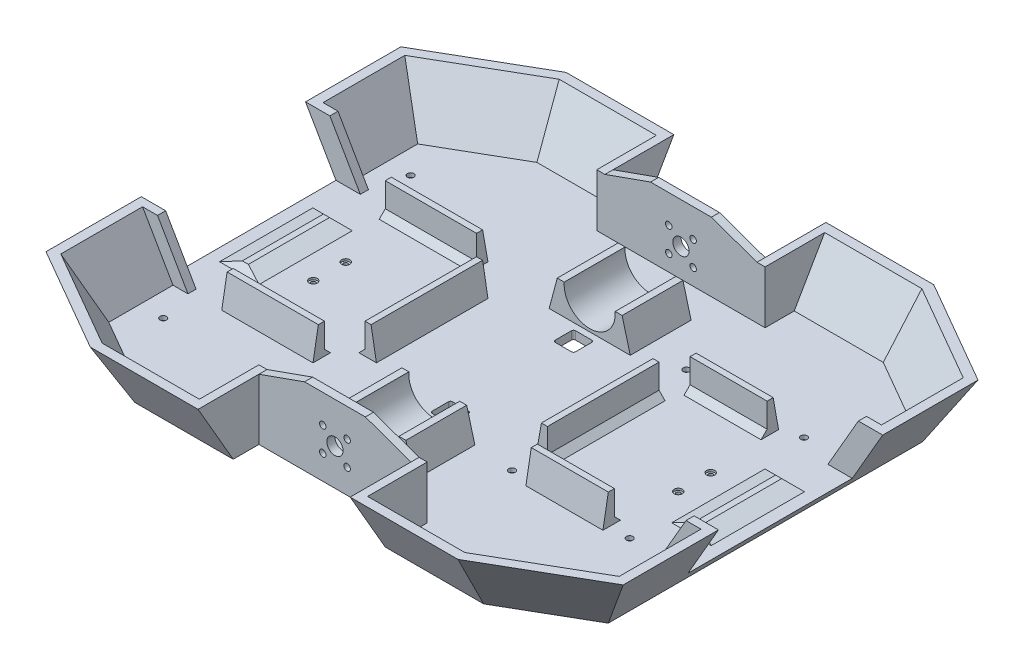
from build123d import *
from OCP.BRepFilletAPI import BRepFilletAPI_MakeChamfer

# Parameters (mm, degrees)
BOSS_EXTRUDE1_DEPTH                      = 30
DRAFT1_ANGLE                             = 30
SHELL1_T                                 = -4
SKETCH2_W                                = 75
SKETCH2_H                                = 30
CUT_EXTRUDE1_DEPTH                       = 187.866874095
BOSS_EXTRUDE2_DEPTH                      = 4
BOSS_EXTRUDE4_DEPTH                      = 4
SKETCH5_R                                = 1.6
SKETCH5_R_2                              = 4
CUT_EXTRUDE2_DEPTH                       = 5
SKETCH9_W                                = 30
SKETCH9_H                                = 30
BOSS_EXTRUDE5_DEPTH                      = 15
CUT_EXTRUDE5_REACH                       = 238.985
SKETCH10_R                               = 12.6
CHAMFER4_SIZE                            = 5
CHAMFER4_SIZE_2                          = 18.660254038
SKETCH15_W                               = 10
SKETCH15_H                               = 10
CUT_EXTRUDE8_DEPTH                       = 188.550602862
FILLET1_R                                = 1
MIRROR4_COPY_1_DEPTH                     = 4
CHAMFER4_OF_MIRROR4_SIZE                 = 5
CHAMFER4_OF_MIRROR4_SIZE_2               = 18.660254038
FILLET1_OF_MIRROR4_R                     = 1
CUT_EXTRUDE9_REACH                       = 190.317
SKETCH16_R                               = 1.1
SKETCH17_R                               = 2
CUT_EXTRUDE10_DEPTH                      = 1
SKETCH6_R                                = 1.6
CUT_EXTRUDE3_DEPTH                       = 5
SKETCH7_R                                = 3.5
CUT_EXTRUDE4_DEPTH                       = 2
SKETCH19_R                               = 1.6
CUT_EXTRUDE11_DEPTH                      = 188.550602862
SKETCH20_R                               = 3.5
CUT_EXTRUDE12_DEPTH                      = 2
SKETCH18_W                               = 45
SKETCH18_H                               = 3
SKETCH18_W_2                             = 3
SKETCH18_H_2                             = 55
SKETCH18_W_3                             = 38
BOSS_EXTRUDE8_DEPTH                      = 15
CHAMFER9_SIZE                            = 2.644904711
CHAMFER9_SIZE_2                          = 15
CHAMFER13_SIZE                           = 3
SKETCH21_W                               = 3
SKETCH21_H                               = 40
BOSS_EXTRUDE9_DEPTH                      = 3
CHAMFER10_SIZE                           = 8.242432258
CHAMFER10_SIZE_2                         = 3
CHAMFER11_SIZE                           = 3
CUT_EXTRUDE13_START                      = -19.629909
SKETCH22_W                               = 81
SKETCH22_H                               = 26
CUT_EXTRUDE13_DEPTH                      = 19.629909
BOSS_EXTRUDE10_DEPTH                     = 4
MIRROR6_AT_THE_SECOND_PLANE_COPY_1_DEPTH = 4


# Some blends are built 0.0001 mm under size
with BuildPart() as part:
    # Sketch1 → Boss-Extrude1 (new body)
    with BuildSketch(Plane(origin=(0, 0, 0), x_dir=(1, 0, 0), z_dir=(0, 1, 0))):
        Polygon((-125, 77.5), (-86.02885683, 100), (86.02885683, 100), (125, 77.5), (125, -77.5), (86.02885683, -100), (-86.02885683, -100), (-125, -77.5), align=None)
    extrude(amount=BOSS_EXTRUDE1_DEPTH)

    # Draft1
    draft1_faces = [part.faces().sort_by_distance(p)[0] for p in [
        (-105.514428415, 15, 88.75),
        (0, 15, 100),
        (105.514428415, 15, 88.75),
        (125, 15, 0),
        (105.514428415, 15, -88.75),
        (0, 15, -100),
        (-105.514428415, 15, -88.75),
        (-125, 15, 0),
    ]]
    draft(draft1_faces, Plane(origin=(0, 0, 0), x_dir=(0, 0, -1), z_dir=(0, -1, 0)), DRAFT1_ANGLE)

    # Shell1
    shell1_openings = [part.faces().sort_by_distance(p)[0] for p in [
        (0, 30, 0),
    ]]
    offset(amount=SHELL1_T, openings=shell1_openings, kind=Kind.INTERSECTION)

    # Sketch2 → Cut-Extrude1 (cut, through all)
    with BuildSketch(Plane(origin=(0, 30, 0), x_dir=(1, 0, 0), z_dir=(0, 1, 0))):
        with Locations((0, -102.320508076)):
            Rectangle(SKETCH2_W, SKETCH2_H)
    cut_extrude1 = extrude(amount=-CUT_EXTRUDE1_DEPTH, mode=Mode.SUBTRACT)

    # Sketch3 → Boss-Extrude2 (add)
    with BuildSketch(Plane.XY.offset(87.320508076)):
        Polygon((-37.5, 4), (-37.5, 30), (-15, 38), (15, 38), (37.5, 30), (37.5, 4), align=None)
    boss_extrude2 = extrude(amount=-BOSS_EXTRUDE2_DEPTH)

    # Sketch4 → Boss-Extrude4 (add)
    with BuildSketch(Plane(origin=(37.5, 0, 0), x_dir=(0, 0, -1), z_dir=(1, 0, 0))):
        Polygon((-83.320508076, 30), (-117.320508076, 30), (-100, 0), (-83.320508076, 0), align=None)
    boss_extrude4 = extrude(amount=BOSS_EXTRUDE4_DEPTH)

    # Mirror1: Boss-Extrude4 across plane
    add(boss_extrude4.mirror(Plane(origin=(0, 0, 0), x_dir=(0, 0, 1), z_dir=(1, 0, 0))))

    # Sketch5 → Cut-Extrude2 (cut)
    with BuildSketch(Plane.XY.offset(87.320508076)):
        with Locations((-6.01040764, 24.01040764)):
            Circle(SKETCH5_R)
        with Locations((6.01040764, 24.01040764)):
            Circle(SKETCH5_R)
        with Locations((6.01040764, 11.98959236)):
            Circle(SKETCH5_R)
        with Locations((-6.01040764, 11.98959236)):
            Circle(SKETCH5_R)
        with Locations((0, 18)):
            Circle(SKETCH5_R_2)
        with Locations((0, 18)):
            Circle(SKETCH5_R_2)
    cut_extrude2 = extrude(amount=-CUT_EXTRUDE2_DEPTH, mode=Mode.SUBTRACT)

    # Sketch9 → Boss-Extrude5 (add)
    with BuildSketch(Plane(origin=(0, 4, 0), x_dir=(1, 0, 0), z_dir=(0, 1, 0))):
        with Locations((0, -53.320508076)):
            Rectangle(SKETCH9_W, SKETCH9_H)
    boss_extrude5 = extrude(amount=BOSS_EXTRUDE5_DEPTH)

    # Sketch10 → Cut-Extrude5 (cut, up to next)
    with BuildSketch(Plane.XY.offset(68.320508076), mode=Mode.PRIVATE) as cut_extrude5_sk1:
        with Locations((0, 18)):
            Circle(SKETCH10_R)
    cut_extrude5_tool1 = extrude(cut_extrude5_sk1.sketch, amount=-CUT_EXTRUDE5_REACH, mode=Mode.PRIVATE) & part.part
    cut_extrude5 = cut_extrude5_tool1.solids().sort_by_distance((0, 18, 68.320508))[0]
    add(cut_extrude5, mode=Mode.SUBTRACT)

    # Chamfer4
    # the kernel refuses this chamfer: 18.660254038, 5 mm, written as the material it adds along each edge
    with BuildSketch(Plane(origin=(-15, 4, 68.320508076), x_dir=(-0.9905000388259539, -0.13751244702129145, 0), z_dir=(0, 0, -1))) as chamfer4_piece_1_section:
        Polygon((CHAMFER4_SIZE * 0.990500038826, CHAMFER4_SIZE * 0.137512447021), (-CHAMFER4_SIZE_2 * 0.13751244702, CHAMFER4_SIZE_2 * 0.990500038818), (0, 0), align=None)
    chamfer4_piece_1 = extrude(amount=30, mode=Mode.PRIVATE)
    chamfer4_piece_1 = split(chamfer4_piece_1, bisect_by=Plane(origin=(-16.582933596, 19, 53.320508076), z_dir=(0, -1, 0)), keep=Keep.TOP, mode=Mode.PRIVATE)
    add(chamfer4_piece_1)
    with BuildSketch(Plane(origin=(15, 4, 38.320508076), x_dir=(0.9905000388259539, -0.13751244702129142, -3.3430148849499233e-15), z_dir=(0, 0, 1))) as chamfer4_piece_2_section:
        Polygon((CHAMFER4_SIZE * 0.990500038826, CHAMFER4_SIZE * 0.137512447021), (-CHAMFER4_SIZE_2 * 0.13751244702, CHAMFER4_SIZE_2 * 0.990500038818), (0, 0), align=None)
    chamfer4_piece_2 = extrude(amount=30, mode=Mode.PRIVATE)
    chamfer4_piece_2 = split(chamfer4_piece_2, bisect_by=Plane(origin=(16.582933596, 19, 53.320508076), z_dir=(0, -1, 0)), keep=Keep.TOP, mode=Mode.PRIVATE)
    add(chamfer4_piece_2)

    # Sketch15 → Cut-Extrude8 (cut, through all)
    with BuildSketch(Plane(origin=(0, 4, 0), x_dir=(1, 0, 0), z_dir=(0, 1, 0))):
        with Locations((0, -30.320508076)):
            Rectangle(SKETCH15_W, SKETCH15_H)
    cut_extrude8 = extrude(amount=-CUT_EXTRUDE8_DEPTH, mode=Mode.SUBTRACT)

    # Fillet1
    fillet1_edges = [part.edges().sort_by_distance(p)[0] for p in [
        (-5, 2, 35.320508076),
        (-5, 2, 25.320508076),
        (5, 2, 25.320508076),
        (5, 2, 35.320508076),
    ]]
    fillet(fillet1_edges, radius=FILLET1_R)

    # Mirror4: Cut-Extrude1, Boss-Extrude2, Boss-Extrude4, Cut-Extrude2, Boss-Extrude5, Cut-Extrude5, Cut-Extrude8 across plane
    add(cut_extrude1.mirror(Plane.XY), mode=Mode.SUBTRACT)
    add(boss_extrude2.mirror(Plane.XY))
    add(boss_extrude4.mirror(Plane.XY))
    add(cut_extrude2.mirror(Plane.XY), mode=Mode.SUBTRACT)
    add(boss_extrude5.mirror(Plane.XY))
    add(cut_extrude5.mirror(Plane.XY), mode=Mode.SUBTRACT)
    add(cut_extrude8.mirror(Plane.XY), mode=Mode.SUBTRACT)

    # Mirror4 copy 1 sketch → Mirror4 copy 1 (add)
    with BuildSketch(Plane.ZY.offset(37.5)):
        Polygon((-83.320508076, 30), (-117.320508076, 30), (-100, 0), (-83.320508076, 0), align=None)
    extrude(amount=MIRROR4_COPY_1_DEPTH)

    # Chamfer4 of Mirror4
    # the kernel refuses this chamfer: 18.660254038, 5 mm, written as the material it adds along each edge
    with BuildSketch(Plane(origin=(-15, 4, -68.320508076), x_dir=(-0.9905000388259539, -0.13751244702129145, 0), z_dir=(0, 0, 1))) as chamfer4_of_mirror4_piece_1_section:
        Polygon((CHAMFER4_OF_MIRROR4_SIZE * 0.990500038826, -CHAMFER4_OF_MIRROR4_SIZE * 0.137512447021), (-CHAMFER4_OF_MIRROR4_SIZE_2 * 0.13751244702, -CHAMFER4_OF_MIRROR4_SIZE_2 * 0.990500038818), (0, 0), align=None)
    chamfer4_of_mirror4_piece_1 = extrude(amount=30, mode=Mode.PRIVATE)
    chamfer4_of_mirror4_piece_1 = split(chamfer4_of_mirror4_piece_1, bisect_by=Plane(origin=(-16.582933596, 19, -53.320508076), z_dir=(0, -1, 0)), keep=Keep.TOP, mode=Mode.PRIVATE)
    add(chamfer4_of_mirror4_piece_1)
    with BuildSketch(Plane(origin=(15, 4, -38.320508076), x_dir=(0.9905000388259539, -0.13751244702129142, 3.3430148849499233e-15), z_dir=(0, 0, -1))) as chamfer4_of_mirror4_piece_2_section:
        Polygon((CHAMFER4_OF_MIRROR4_SIZE * 0.990500038826, -CHAMFER4_OF_MIRROR4_SIZE * 0.137512447021), (-CHAMFER4_OF_MIRROR4_SIZE_2 * 0.13751244702, -CHAMFER4_OF_MIRROR4_SIZE_2 * 0.990500038818), (0, 0), align=None)
    chamfer4_of_mirror4_piece_2 = extrude(amount=30, mode=Mode.PRIVATE)
    chamfer4_of_mirror4_piece_2 = split(chamfer4_of_mirror4_piece_2, bisect_by=Plane(origin=(16.582933596, 19, -53.320508076), z_dir=(0, -1, 0)), keep=Keep.TOP, mode=Mode.PRIVATE)
    add(chamfer4_of_mirror4_piece_2)

    # Fillet1 of Mirror4
    fillet1_of_mirror4_edges = [part.edges().sort_by_distance(p)[0] for p in [
        (-5, 2, -35.320508076),
        (-5, 2, -25.320508076),
        (5, 2, -25.320508076),
        (5, 2, -35.320508076),
    ]]
    fillet(fillet1_of_mirror4_edges, radius=FILLET1_OF_MIRROR4_R)

    # Sketch16 → Cut-Extrude9 (cut, up to next)
    with BuildSketch(Plane.XZ, mode=Mode.PRIVATE) as cut_extrude9_sk1:
        with Locations(Location((-90, -8, 0), (0, 0, 270))):
            Circle(SKETCH16_R)
    cut_extrude9_tool1 = extrude(cut_extrude9_sk1.sketch, amount=-CUT_EXTRUDE9_REACH, mode=Mode.PRIVATE) & part.part
    # Sketch16 → Cut-Extrude9 (cut, up to next)
    with BuildSketch(Plane.XZ, mode=Mode.PRIVATE) as cut_extrude9_sk2:
        with Locations(Location((-90, 8, 0), (0, 0, 270))):
            Circle(SKETCH16_R)
    cut_extrude9_tool2 = extrude(cut_extrude9_sk2.sketch, amount=-CUT_EXTRUDE9_REACH, mode=Mode.PRIVATE) & part.part
    # Sketch16 → Cut-Extrude9 (cut, up to next)
    with BuildSketch(Plane.XZ, mode=Mode.PRIVATE) as cut_extrude9_sk3:
        with Locations(Location((90, -8, 0), (0, 0, 270))):
            Circle(SKETCH16_R)
    cut_extrude9_tool3 = extrude(cut_extrude9_sk3.sketch, amount=-CUT_EXTRUDE9_REACH, mode=Mode.PRIVATE) & part.part
    # Sketch16 → Cut-Extrude9 (cut, up to next)
    with BuildSketch(Plane.XZ, mode=Mode.PRIVATE) as cut_extrude9_sk4:
        with Locations(Location((90, 8, 0), (0, 0, 270))):
            Circle(SKETCH16_R)
    cut_extrude9_tool4 = extrude(cut_extrude9_sk4.sketch, amount=-CUT_EXTRUDE9_REACH, mode=Mode.PRIVATE) & part.part
    add(cut_extrude9_tool1.solids().sort_by_distance((-90, 0, -8))[0], mode=Mode.SUBTRACT)
    add(cut_extrude9_tool2.solids().sort_by_distance((-90, 0, 8))[0], mode=Mode.SUBTRACT)
    add(cut_extrude9_tool3.solids().sort_by_distance((90, 0, -8))[0], mode=Mode.SUBTRACT)
    add(cut_extrude9_tool4.solids().sort_by_distance((90, 0, 8))[0], mode=Mode.SUBTRACT)

    # Sketch17 → Cut-Extrude10 (cut)
    with BuildSketch(Plane(origin=(0, 4, 0), x_dir=(1, 0, 0), z_dir=(0, 1, 0))):
        with Locations(Location((-90, 8, 0), (0, 0, 270))):
            Circle(SKETCH17_R)
        with Locations(Location((-90, -8, 0), (0, 0, 270))):
            Circle(SKETCH17_R)
        with Locations(Location((90, 8, 0), (0, 0, 270))):
            Circle(SKETCH17_R)
        with Locations(Location((90, -8, 0), (0, 0, 270))):
            Circle(SKETCH17_R)
    extrude(amount=-CUT_EXTRUDE10_DEPTH, mode=Mode.SUBTRACT)

    # Sketch6 → Cut-Extrude3 (cut)
    with BuildSketch(Plane(origin=(0, 4, 0), x_dir=(1, 0, 0), z_dir=(0, 1, 0))):
        with Locations(Location((-111, 61, 0), (0, 0, 270))):
            Circle(SKETCH6_R)
        with Locations(Location((-24, 61, 0), (0, 0, 270))):
            Circle(SKETCH6_R)
        with Locations(Location((-111, -61, 0), (0, 0, 270))):
            Circle(SKETCH6_R)
        with Locations(Location((-24, -61, 0), (0, 0, 270))):
            Circle(SKETCH6_R)
    extrude(amount=-CUT_EXTRUDE3_DEPTH, mode=Mode.SUBTRACT)

    # Sketch7 → Cut-Extrude4 (cut)
    with BuildSketch(Plane.XZ):
        with Locations(Location((-111, 61, 0), (0, 0, 270))):
            Circle(SKETCH7_R)
        with Locations(Location((-24, 61, 0), (0, 0, 270))):
            Circle(SKETCH7_R)
        with Locations(Location((-24, -61, 0), (0, 0, 270))):
            Circle(SKETCH7_R)
        with Locations(Location((-111, -61, 0), (0, 0, 270))):
            Circle(SKETCH7_R)
    extrude(amount=-CUT_EXTRUDE4_DEPTH, mode=Mode.SUBTRACT)

    # Sketch19 → Cut-Extrude11 (cut, through all)
    with BuildSketch(Plane(origin=(0, 4, 0), x_dir=(1, 0, 0), z_dir=(0, 1, 0))):
        with Locations(Location((40, -40, 0), (0, 0, 270))):
            Circle(SKETCH19_R)
        with Locations(Location((98, -40, 0), (0, 0, 270))):
            Circle(SKETCH19_R)
        with Locations(Location((40, 46, 0), (0, 0, 270))):
            Circle(SKETCH19_R)
        with Locations(Location((98, 46, 0), (0, 0, 270))):
            Circle(SKETCH19_R)
    extrude(amount=-CUT_EXTRUDE11_DEPTH, mode=Mode.SUBTRACT)

    # Sketch20 → Cut-Extrude12 (cut)
    with BuildSketch(Plane.XZ):
        with Locations(Location((98, 40, 0), (0, 0, 270))):
            Circle(SKETCH20_R)
        with Locations(Location((40, 40, 0), (0, 0, 270))):
            Circle(SKETCH20_R)
        with Locations(Location((98, -46, 0), (0, 0, 270))):
            Circle(SKETCH20_R)
        with Locations(Location((40, -46, 0), (0, 0, 270))):
            Circle(SKETCH20_R)
    extrude(amount=-CUT_EXTRUDE12_DEPTH, mode=Mode.SUBTRACT)

    # Sketch18 → Boss-Extrude8 (add)
    with BuildSketch(Plane(origin=(0, 4, 0), x_dir=(1, 0, 0), z_dir=(0, 1, 0))):
        with Locations((-77.5, 39)):
            Rectangle(SKETCH18_W, SKETCH18_H)
        with Locations((-77.5, -39)):
            Rectangle(SKETCH18_W, SKETCH18_H)
        with Locations((-43.5, 0)):
            Rectangle(SKETCH18_W_2, SKETCH18_H_2)
        with Locations((69, -39)):
            Rectangle(SKETCH18_W_3, SKETCH18_H)
        with Locations((43.5, 0)):
            Rectangle(SKETCH18_W_2, SKETCH18_H_2)
        with Locations((69.320508076, 39)):
            Rectangle(SKETCH18_W_3, SKETCH18_H)
    extrude(amount=BOSS_EXTRUDE8_DEPTH)

    # Chamfer9
    chamfer9_edges_1 = [part.edges().sort_by_distance(p)[0] for p in [
        (42, 4, 0),
    ]]
    chamfer9_side_1 = [part.faces().sort_by_distance(p)[0] for p in [
        (41.947101906, 4, 0),
    ]]
    chamfer9_edges_2 = [part.edges().sort_by_distance(p)[0] for p in [
        (69, 4, 40.5),
    ]]
    chamfer9_side_2 = [part.faces().sort_by_distance(p)[0] for p in [
        (69, 4, 40.552898094),
    ]]
    chamfer9_edges_3 = [part.edges().sort_by_distance(p)[0] for p in [
        (-77.5, 4, -40.5),
    ]]
    chamfer9_side_3 = [part.faces().sort_by_distance(p)[0] for p in [
        (-77.5, 4, -40.552898094),
    ]]
    chamfer9_edges_4 = [part.edges().sort_by_distance(p)[0] for p in [
        (-77.5, 4, 40.5),
    ]]
    chamfer9_side_4 = [part.faces().sort_by_distance(p)[0] for p in [
        (-77.5, 4, 40.552898094),
    ]]
    chamfer9_edges_5 = [part.edges().sort_by_distance(p)[0] for p in [
        (-42, 4, 0),
    ]]
    chamfer9_side_5 = [part.faces().sort_by_distance(p)[0] for p in [
        (-41.947101906, 4, 0),
    ]]
    chamfer9_edges_6 = [part.edges().sort_by_distance(p)[0] for p in [
        (69.320508076, 4, -40.5),
    ]]
    chamfer9_side_6 = [part.faces().sort_by_distance(p)[0] for p in [
        (69.320508076, 4, -40.552898094),
    ]]
    chamfer9 = BRepFilletAPI_MakeChamfer(part.part.solid().wrapped)
    for e in chamfer9_edges_1:
        chamfer9.Add(CHAMFER9_SIZE - 0.0001, CHAMFER9_SIZE_2 - 0.0001, e.wrapped, chamfer9_side_1[0].wrapped)
    for e in chamfer9_edges_2:
        chamfer9.Add(CHAMFER9_SIZE - 0.0001, CHAMFER9_SIZE_2 - 0.0001, e.wrapped, chamfer9_side_2[0].wrapped)
    for e in chamfer9_edges_3:
        chamfer9.Add(CHAMFER9_SIZE - 0.0001, CHAMFER9_SIZE_2 - 0.0001, e.wrapped, chamfer9_side_3[0].wrapped)
    for e in chamfer9_edges_4:
        chamfer9.Add(CHAMFER9_SIZE - 0.0001, CHAMFER9_SIZE_2 - 0.0001, e.wrapped, chamfer9_side_4[0].wrapped)
    for e in chamfer9_edges_5:
        chamfer9.Add(CHAMFER9_SIZE - 0.0001, CHAMFER9_SIZE_2 - 0.0001, e.wrapped, chamfer9_side_5[0].wrapped)
    for e in chamfer9_edges_6:
        chamfer9.Add(CHAMFER9_SIZE - 0.0001, CHAMFER9_SIZE_2 - 0.0001, e.wrapped, chamfer9_side_6[0].wrapped)
    add(Compound.cast(chamfer9.Shape()), mode=Mode.REPLACE)  # a hair under: the kernel refuses the full size

    # Chamfer13
    chamfer13_edges = [part.edges().sort_by_distance(p)[0] for p in [
        (-77.5, 4, -37.5),
        (-77.5, 4, 37.5),
        (-45, 4, 0),
        (69, 4, 37.5),
        (45, 4, 0),
        (69.320508076, 4, -37.5),
    ]]
    chamfer(chamfer13_edges, length=CHAMFER13_SIZE)

    # Sketch21 → Boss-Extrude9 (add)
    with BuildSketch(Plane(origin=(0, 4, 0), x_dir=(1, 0, 0), z_dir=(0, 1, 0))):
        with Locations((-111.5, 0)):
            Rectangle(SKETCH21_W, SKETCH21_H)
        with Locations((111.5, 0)):
            Rectangle(SKETCH21_W, SKETCH21_H)
    extrude(amount=BOSS_EXTRUDE9_DEPTH)

    # Chamfer10
    chamfer10_edges_1 = [part.edges().sort_by_distance(p)[0] for p in [
        (113, 4, 0),
    ]]
    chamfer10_side_1 = [part.faces().sort_by_distance(p)[0] for p in [
        (113.06, 4, 0),
    ]]
    chamfer10_edges_2 = [part.edges().sort_by_distance(p)[0] for p in [
        (110, 4, 0),
    ]]
    chamfer10_side_2 = [part.faces().sort_by_distance(p)[0] for p in [
        (109.94, 4, 0),
    ]]
    chamfer10_edges_3 = [part.edges().sort_by_distance(p)[0] for p in [
        (-110, 4, 0),
    ]]
    chamfer10_side_3 = [part.faces().sort_by_distance(p)[0] for p in [
        (-109.94, 4, 0),
    ]]
    chamfer10_edges_4 = [part.edges().sort_by_distance(p)[0] for p in [
        (-113, 4, 0),
    ]]
    chamfer10_side_4 = [part.faces().sort_by_distance(p)[0] for p in [
        (-113.06, 4, 0),
    ]]
    chamfer10 = BRepFilletAPI_MakeChamfer(part.part.solid().wrapped)
    for e in chamfer10_edges_1:
        chamfer10.Add(CHAMFER10_SIZE - 0.0001, CHAMFER10_SIZE_2 - 0.0001, e.wrapped, chamfer10_side_1[0].wrapped)
    for e in chamfer10_edges_2:
        chamfer10.Add(CHAMFER10_SIZE - 0.0001, CHAMFER10_SIZE_2 - 0.0001, e.wrapped, chamfer10_side_2[0].wrapped)
    for e in chamfer10_edges_3:
        chamfer10.Add(CHAMFER10_SIZE - 0.0001, CHAMFER10_SIZE_2 - 0.0001, e.wrapped, chamfer10_side_3[0].wrapped)
    for e in chamfer10_edges_4:
        chamfer10.Add(CHAMFER10_SIZE - 0.0001, CHAMFER10_SIZE_2 - 0.0001, e.wrapped, chamfer10_side_4[0].wrapped)
    add(Compound.cast(chamfer10.Shape()), mode=Mode.REPLACE)  # a hair under: the kernel refuses the full size

    # Chamfer11
    chamfer11_edges = [part.edges().sort_by_distance(p)[0] for p in [
        (111.5, 4, -20),
        (-111.5, 4, 20),
        (-111.5, 4, -20),
        (111.5, 4, 20),
    ]]
    chamfer(chamfer11_edges, length=CHAMFER11_SIZE - 0.0001)  # a hair under: the kernel refuses the full size

    # Sketch22 → Cut-Extrude13 (cut)
    with BuildSketch(Plane.ZY.offset(142.320508076).offset(CUT_EXTRUDE13_START)):
        with Locations((0, 17)):
            Rectangle(SKETCH22_W, SKETCH22_H)
    cut_extrude13 = extrude(amount=CUT_EXTRUDE13_DEPTH, mode=Mode.SUBTRACT)

    # Mirror5: Cut-Extrude13 across plane
    add(cut_extrude13.mirror(Plane(origin=(0, 0, 0), x_dir=(0, 0, 1), z_dir=(1, 0, 0))), mode=Mode.SUBTRACT)

    # Sketch23 → Boss-Extrude10 (add)
    with BuildSketch(Plane(origin=(0, 0, 40.5), x_dir=(-1, 0, 0), z_dir=(0, 0, -1))):
        Polygon((-142.320508076, 30), (-127.309401077, 4), (-115.309401077, 4), (-130.320508076, 30), align=None)
    boss_extrude10 = extrude(amount=-BOSS_EXTRUDE10_DEPTH)

    # Mirror6: Boss-Extrude10 across plane
    add(boss_extrude10.mirror(Plane.XY))

    # Mirror6 at the second plane: Boss-Extrude10 across plane
    add(boss_extrude10.mirror(Plane(origin=(0, 0, 0), x_dir=(0, 0, 1), z_dir=(1, 0, 0))))

    # Mirror6 at the second plane copy 1 sketc → Mirror6 at the second plane copy 1 (add)
    with BuildSketch(Plane.XY.offset(-40.5)):
        Polygon((-142.320508076, 30), (-127.309401077, 4), (-115.309401077, 4), (-130.320508076, 30), align=None)
    extrude(amount=-MIRROR6_AT_THE_SECOND_PLANE_COPY_1_DEPTH)


solid = part.part
